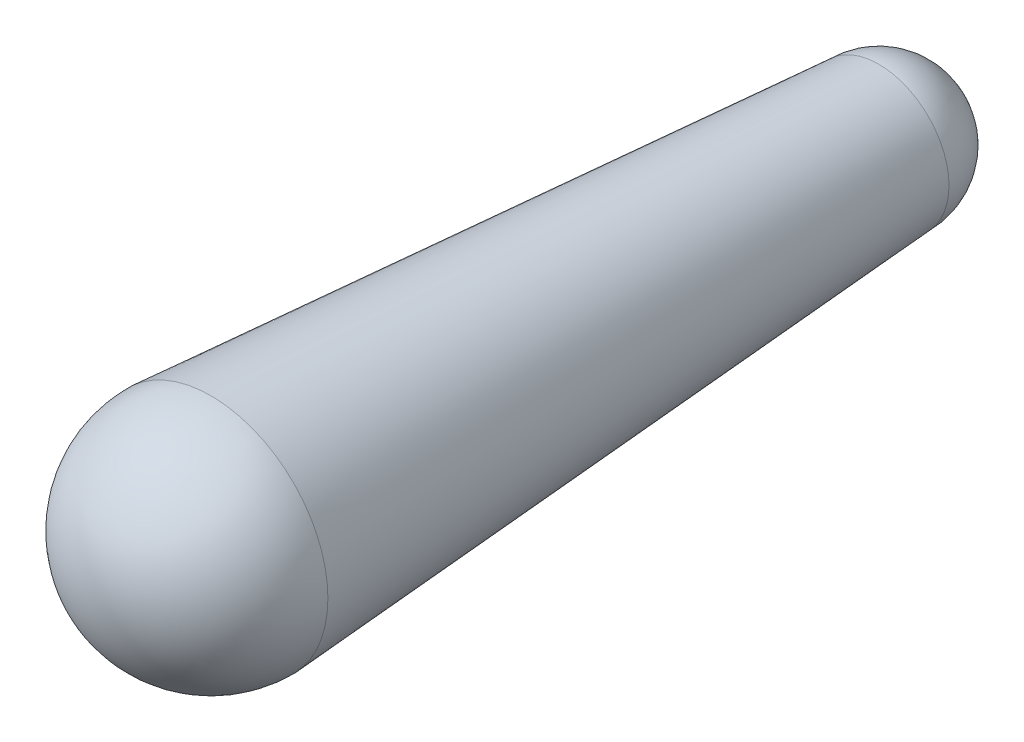
from build123d import *

# Parameters (mm, degrees)
SKETCH1_R           = 44.45
BOSS_EXTRUDE1_DEPTH = 254
BOSS_EXTRUDE1_DRAFT = -4


# Read off the part's stored shape, not the designer's step: Revolve1
with BuildPart() as part:
    # Sketch1 → Boss-Extrude1 (with draft: the straight prism first)
    with BuildSketch(Plane.XY):
        Circle(SKETCH1_R)
    extrude(amount=-BOSS_EXTRUDE1_DEPTH)
    # Boss-Extrude1: the draft: its side faces are tilted about the plane it starts from
    boss_extrude1_sides = [part.faces().sort_by_distance(p)[0] for p in [
        (-44.45, 0, -127),
    ]]
    draft(boss_extrude1_sides, Plane.XY, BOSS_EXTRUDE1_DRAFT)

    # Revolve1 outline → Revolve1 (revolve)
    with BuildSketch(Plane.XZ):
        with BuildLine():
            Line((0, 0), (44.45, -4.4e-08))
            ThreePointArc((44.45, -4.4e-08), (31.430896439, 31.430896408), (0, 44.45))
            Line((0, 44.45), (0, 0))
        make_face()
    revolve(axis=Axis((0, 0, 0), (0, 0, 1)))

    # Sketch5 → Revolve2 (revolve)
    with BuildSketch(Plane(origin=(0, 0, 0), x_dir=(0, 0, -1), z_dir=(1, 0, 0))):
        with BuildLine():
            Line((254, 26.688589766), (254, -26.688589766))
            ThreePointArc((254, -26.688589766), (280.688589766, 0), (254, 26.688589766))
        make_face()
    revolve(axis=Axis((0, 26.688589766, -254), (0, -1, 0)))


solid = part.part
